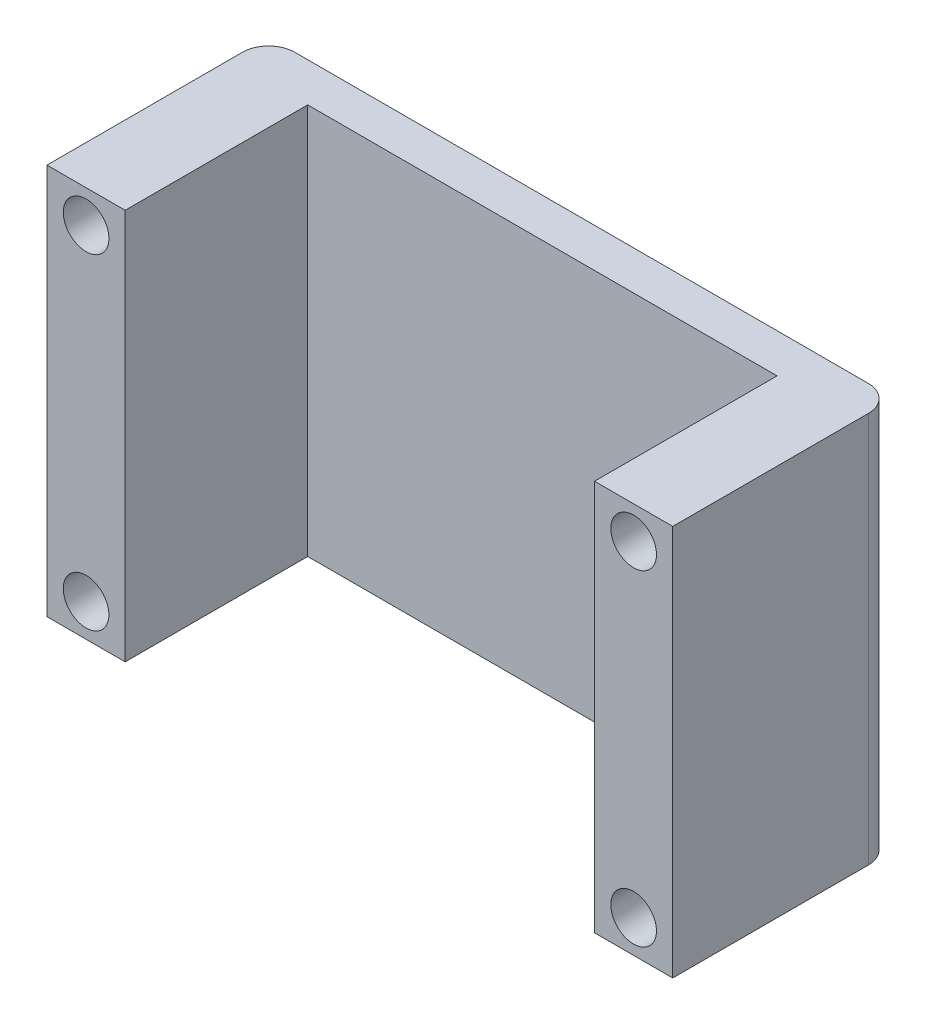
from build123d import *

# Parameters (mm, degrees)
CROQUIS1_R              = 1.75
SALIENTE_EXTRUIR1_DEPTH = 3
CROQUIS3_W              = 6
CROQUIS3_H              = 30
CROQUIS3_R              = 1.75
SALIENTE_EXTRUIR4_DEPTH = 14
REDONDEO1_R             = 2


with BuildPart() as part:
    # Croquis1 → Saliente-Extruir1 (new body)
    # profile 1 of 2: a face of its own
    with BuildSketch(Plane.XY):
        Polygon((-24, 12.5), (24, 12.5), (24, 22.5), (24, 27.5), (-24, 27.5), (-24, 22.5), align=None)
        with Locations((-21, 25)):
            Circle(CROQUIS1_R, mode=Mode.SUBTRACT)
        with Locations((21, 25)):
            Circle(CROQUIS1_R, mode=Mode.SUBTRACT)
    # profile 2 of 2: a face of its own
    with BuildSketch(Plane.XY):
        Polygon((-24, -2.5), (24, -2.5), (24, 2.5), (24, 12.5), (-24, 12.5), (-24, 2.5), align=None)
        with Locations((-21, 0)):
            Circle(CROQUIS1_R, mode=Mode.SUBTRACT)
        with Locations((21, 0)):
            Circle(CROQUIS1_R, mode=Mode.SUBTRACT)
    extrude(amount=SALIENTE_EXTRUIR1_DEPTH)

    # Croquis3 → Saliente-Extruir4 (add)
    # profile 1 of 2: a face of its own
    with BuildSketch(Plane.XY.offset(3)):
        with Locations((-21, 12.5)):
            Rectangle(CROQUIS3_W, CROQUIS3_H)
        with Locations((-21, 0)):
            Circle(CROQUIS3_R, mode=Mode.SUBTRACT)
        with Locations((-21, 25)):
            Circle(CROQUIS3_R, mode=Mode.SUBTRACT)
    # profile 2 of 2: a face of its own
    with BuildSketch(Plane.XY.offset(3)):
        with Locations((21, 12.5)):
            Rectangle(CROQUIS3_W, CROQUIS3_H)
        with Locations((21, 0)):
            Circle(CROQUIS3_R, mode=Mode.SUBTRACT)
        with Locations((21, 25)):
            Circle(CROQUIS3_R, mode=Mode.SUBTRACT)
    extrude(amount=SALIENTE_EXTRUIR4_DEPTH)

    # Redondeo1
    # the kernel refuses this fillet: 2 mm, written as the material it takes off along each edge
    with BuildSketch(Plane(origin=(-24, 32.5, 0), x_dir=(1, 0, 0), z_dir=(0, -1, 0)), Plane(origin=(24, -7.5, 0), x_dir=(-1, 0, 0), z_dir=(0, 1, 0))) as redondeo1_piece_1:
        with BuildLine():
            CenterArc((REDONDEO1_R, REDONDEO1_R), REDONDEO1_R, 180, 90)
            Line((0, REDONDEO1_R), (0, 0))
            Line((0, 0), (REDONDEO1_R, 0))
        make_face()
    extrude(amount=40, mode=Mode.SUBTRACT)


solid = part.part
